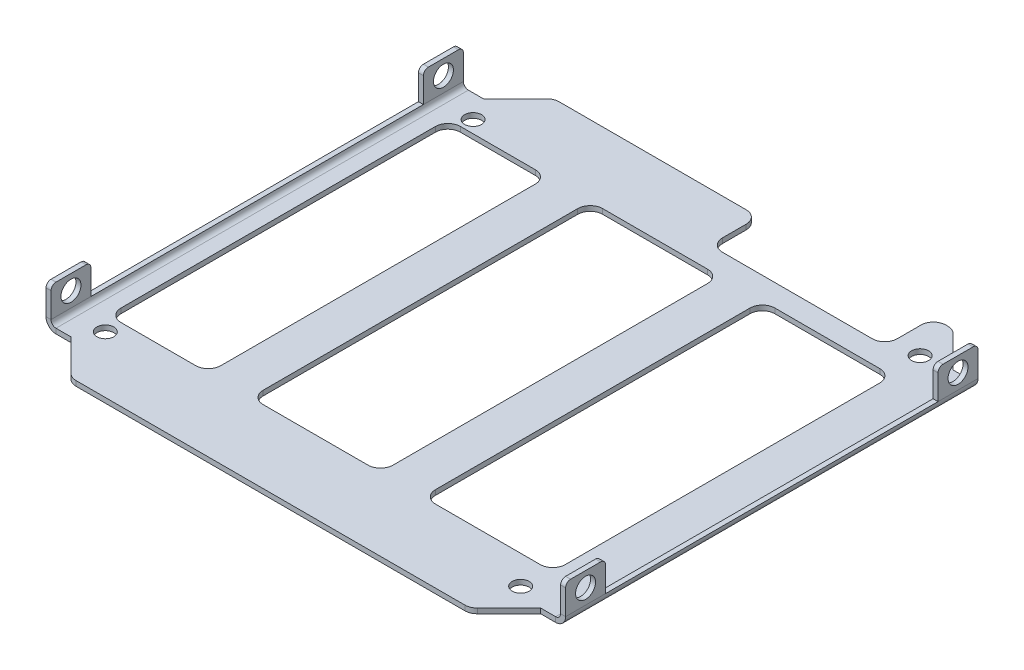
from build123d import *

# Parameters (mm, degrees)
SKETCH1_W                      = 89
SKETCH1_H                      = 68
BASE_FLANGE2_DEPTH             = 1
EDGE_FLANGE1_STRIP_W           = 6
EDGE_FLANGE1_STRIP_H           = 1
EDGE_FLANGE1_STRIP_CUT_DEPTH   = 82.6
EDGE_FLANGE1_STRIP_2_W         = 6
EDGE_FLANGE1_STRIP_2_H         = 1
EDGE_FLANGE1_STRIP_CUT_2_DEPTH = 82.6
EDGE_FLANGE1_DEPTH             = 82.6
EDGE_FLANGE1_BEND_DEPTH        = 82.6
SKETCH16_W                     = 66.6
SKETCH16_H                     = 7
CUT_EXTRUDE1_DEPTH             = 138.553195479
FILLET1_R                      = 1
SKETCH17_R                     = 2
CUT_EXTRUDE2_DEPTH             = 138.553195479
M3_CLEARANCE_HOLE1_D           = 3.4
FILLET2_R                      = 2.5
SKETCH20_W                     = 8.5
SKETCH20_H                     = 68
BOSS_EXTRUDE1_DEPTH            = 1
FILLET3_R                      = 2.5


# Sheet-metal steps are written as plain solids
with BuildPart() as part:
    # Sketch1 → Base-Flange2 (new body)
    with BuildSketch(Plane(origin=(0, 0, 0), x_dir=(1, 0, 0), z_dir=(0, 1, 0))):
        Polygon((0, 0), (0, 82.6), (5, 82.6), (12.071067812, 89.671067812), (53.072, 89.671067812), (53.072, 79.921067812), (88.072, 79.921067812), (88.072, 89.671067812), (92.000932188, 89.671067812), (99.072, 82.6), (104.072, 82.6), (104.072, 0), (99.072, 0), (92.000932188, -7.071067812), (12.071067812, -7.071067812), (5, 0), align=None)
        with Locations((49.5, 41.5)):
            Rectangle(SKETCH1_W, SKETCH1_H, mode=Mode.SUBTRACT)
    extrude(amount=-BASE_FLANGE2_DEPTH)

    # Edge-Flange1 strip (across the edge) → Edge-Flange1 strip cut (cut)
    with BuildSketch(Plane(origin=(104.072, 0, 0), x_dir=(-1, 0, 0), z_dir=(0, 0, -1))):
        with Locations((-1, -0.5)):
            Rectangle(EDGE_FLANGE1_STRIP_W, EDGE_FLANGE1_STRIP_H)
    extrude(amount=EDGE_FLANGE1_STRIP_CUT_DEPTH, mode=Mode.SUBTRACT)

    # Edge-Flange1 strip 2 (across the edge) → Edge-Flange1 strip cut 2 (cut)
    with BuildSketch(Plane.XY.offset(-82.6)):
        with Locations((-1, -0.5)):
            Rectangle(EDGE_FLANGE1_STRIP_2_W, EDGE_FLANGE1_STRIP_2_H)
    extrude(amount=EDGE_FLANGE1_STRIP_CUT_2_DEPTH, mode=Mode.SUBTRACT)

    # Edge-Flange1 section (across the edge) → Edge-Flange1 (add)
    with BuildSketch(Plane(origin=(104.072, 0, 0), x_dir=(-1, 0, 0), z_dir=(0, 0, -1))):
        with BuildLine():
            Line((0, 1), (0, 7))
            Line((0, 7), (1, 7))
            Line((1, 7), (1, 1))
            ThreePointArc((1, 1), (1.292893219, 0.292893219), (2, 0))
            Line((2, 0), (2, -1))
            ThreePointArc((2, -1), (0.585786438, -0.414213562), (0, 1))
        make_face()
    extrude(amount=EDGE_FLANGE1_DEPTH)

    # Edge-Flange1 section 2 (across the edge) → Edge-Flange1 bend (add)
    with BuildSketch(Plane.XY.offset(-82.6)):
        with BuildLine():
            Line((0, 1), (0, 7))
            Line((0, 7), (1, 7))
            Line((1, 7), (1, 1))
            ThreePointArc((1, 1), (1.292893219, 0.292893219), (2, 0))
            Line((2, 0), (2, -1))
            ThreePointArc((2, -1), (0.585786438, -0.414213562), (0, 1))
        make_face()
    extrude(amount=EDGE_FLANGE1_BEND_DEPTH)

    # Sketch16 → Cut-Extrude1 (cut, through all)
    with BuildSketch(Plane(origin=(104.072, 0, 0), x_dir=(0, 0, -1), z_dir=(1, 0, 0))):
        with Locations((41.3, 4.5)):
            Rectangle(SKETCH16_W, SKETCH16_H)
    extrude(amount=-CUT_EXTRUDE1_DEPTH, mode=Mode.SUBTRACT)

    # Fillet1
    fillet1_edges = [part.edges().sort_by_distance(p)[0] for p in [
        (0.5, 7, -82.6),
        (0.5, 7, 0),
        (0.5, 7, -74.6),
        (0.5, 7, -8),
        (103.572, 7, -8),
        (103.572, 7, -74.6),
        (103.572, 7, 0),
        (103.572, 7, -82.6),
    ]]
    fillet(fillet1_edges, radius=FILLET1_R)

    # Sketch17 → Cut-Extrude2 (cut, through all)
    with BuildSketch(Plane(origin=(104.072, 0, 0), x_dir=(0, 0, -1), z_dir=(1, 0, 0))):
        with Locations(Location((4, 4, 0), (0, 0, 90))):
            Circle(SKETCH17_R)
        with Locations(Location((78.6, 4, 0), (0, 0, 90))):
            Circle(SKETCH17_R)
    extrude(amount=-CUT_EXTRUDE2_DEPTH, mode=Mode.SUBTRACT)

    # M3 Clearance Hole1 (through all)
    with Locations(Plane(origin=(0, -1, 0), x_dir=(-1, 0, 0), z_dir=(0, -1, 0))):
        with Locations((-93.299383015, 81.780067732), (-7.569381755, 77.970067732), (-7.569381755, 4.310067732), (-93.299383015, 1.770067732)):
            Hole(M3_CLEARANCE_HOLE1_D / 2)

    # Fillet2
    fillet2_edges = [part.edges().sort_by_distance(p)[0] for p in [
        (12.071067812, -0.5, -89.671067812),
        (53.072, -0.5, -89.671067812),
        (53.072, -0.5, -79.921067812),
        (88.072, -0.5, -79.921067812),
        (88.072, -0.5, -89.671067812),
        (92.000932188, -0.5, -89.671067812),
        (92.000932188, -0.5, 7.071067812),
        (12.071067812, -0.5, 7.071067812),
        (5, -0.5, -75.5),
        (94, -0.5, -75.5),
        (94, -0.5, -7.5),
        (5, -0.5, -7.5),
    ]]
    fillet(fillet2_edges, radius=FILLET2_R)

    # Sketch20 → Boss-Extrude1 (add)
    with BuildSketch(Plane.XZ.offset(1)):
        with Locations((29.25, -41.5)):
            Rectangle(SKETCH20_W, SKETCH20_H)
        with Locations((63.75, -41.5)):
            Rectangle(SKETCH20_W, SKETCH20_H)
    extrude(amount=-BOSS_EXTRUDE1_DEPTH)

    # Fillet3
    fillet3_edges = [part.edges().sort_by_distance(p)[0] for p in [
        (33.5, -0.5, -75.5),
        (25, -0.5, -75.5),
        (25, -0.5, -7.5),
        (33.5, -0.5, -7.5),
        (68, -0.5, -75.5),
        (59.5, -0.5, -75.5),
        (59.5, -0.5, -7.5),
        (68, -0.5, -7.5),
    ]]
    fillet(fillet3_edges, radius=FILLET3_R)


solid = part.part
